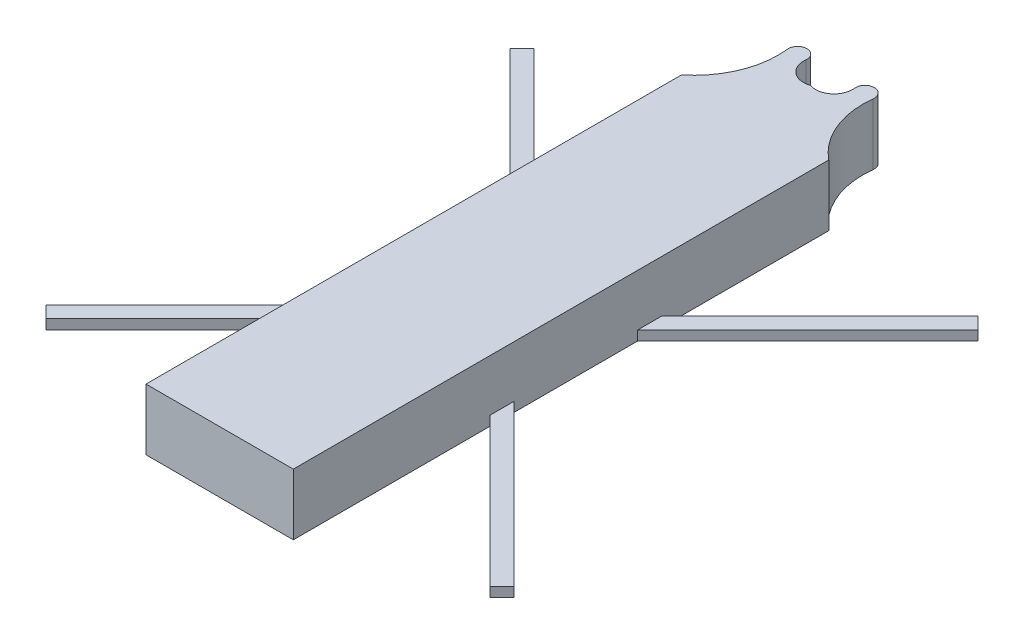
from build123d import *

# Parameters (mm, degrees)
BODY_DEPTH     = 29.21
ARM4_START     = -30.861
SKETCH3_W      = 8.1534
SKETCH3_H      = 4.572
ARM4_DEPTH     = 132.461
ARMS_COUNT     = 4
SPLIT1_DEPTH   = 4.572
SPLIT1_2_DEPTH = 4.572
SPLIT1_3_DEPTH = 4.572
SPLIT1_4_DEPTH = 4.572
SPLIT1_5_DEPTH = 4.572


# Read off the part's stored shape, not the designer's step: Split1
with BuildPart() as part:
    # Sketch1 → Body (new body)
    with BuildSketch(Plane(origin=(0, 0, 0), x_dir=(1, 0, 0), z_dir=(0, 1, 0))):
        with BuildLine():
            Line((-35.1155, -149.86), (35.1155, -149.86))
            Line((35.1155, -149.86), (35.1155, 105.41))
            ThreePointArc((35.1155, 105.41), (23.187155862, 121.433970368), (20.465438127, 141.224))
            ThreePointArc((20.465438127, 141.224), (16.0655, 146.16116691), (11.665561873, 141.224))
            ThreePointArc((11.665561873, 141.224), (8.42304611, 133.309752218), (0, 131.826))
            ThreePointArc((0, 131.826), (-8.42304611, 133.309752218), (-11.665561873, 141.224))
            ThreePointArc((-11.665561873, 141.224), (-16.0655, 146.16116691), (-20.465438127, 141.224))
            ThreePointArc((-20.465438127, 141.224), (-23.187155862, 121.433970368), (-35.1155, 105.41))
            Line((-35.1155, 105.41), (-35.1155, -149.86))
        make_face()
    extrude(amount=BODY_DEPTH)

    # Sketch3 → Arm4 (add)
    with BuildSketch(Plane(origin=(-33.996333455, 0, -33.996333455), x_dir=(-0.7071067811865487, 0, 0.7071067811865465), z_dir=(-0.7071067811865465, 0, -0.7071067811865487)).offset(ARM4_START)):
        with Locations((4.0767, 2.286)):
            Rectangle(SKETCH3_W, SKETCH3_H)
    arm4 = extrude(amount=ARM4_DEPTH)

    # Arms: Arm4 ×4 about axis
    arms_axis = Axis((0, 0, 10.484577686), (0, 1, 0))
    for i in range(1, ARMS_COUNT):
        add(arm4.rotate(arms_axis, i * 360 / ARMS_COUNT))

    # Split1 outline → Split1 (cut)
    with BuildSketch(Plane(origin=(0, 0, 0), x_dir=(1, 0, 0), z_dir=(0, 1, 0))):
        Polygon((-35.1155, 23.584851141), (-35.1155, 35.1155), (-105.838382424, 105.838382424), (-111.603706853, 100.073057994), align=None)
        Polygon((-35.1155, -46.646148859), (-35.1155, -35.1155), (-116.322960109, -116.322960109), (-110.55763568, -122.088284539), align=None)
        Polygon((35.1155, -44.554006512), (35.1155, -56.084655371), (105.838382424, -126.807537795), (111.603706853, -121.042213365), align=None)
        Polygon((35.1155, 25.676993488), (35.1155, 14.146344629), (116.322960109, 95.353804738), (110.55763568, 101.119129168), align=None)
    extrude(amount=SPLIT1_DEPTH, mode=Mode.SUBTRACT)


with BuildPart() as body_2:
    # Split1 2 outline → Split1 2 (new body)
    with BuildSketch(Plane(origin=(0, 0, 0), x_dir=(1, 0, 0), z_dir=(0, 1, 0))):
        Polygon((-35.1155, -46.646148859), (-35.1155, -35.1155), (-116.322960109, -116.322960109), (-110.55763568, -122.088284539), align=None)
    extrude(amount=SPLIT1_2_DEPTH)


with BuildPart() as body_3:
    # Split1 3 outline → Split1 3 (new body)
    with BuildSketch(Plane(origin=(0, 0, 0), x_dir=(1, 0, 0), z_dir=(0, 1, 0))):
        Polygon((-35.1155, 23.584851141), (-35.1155, 35.1155), (-105.838382424, 105.838382424), (-111.603706853, 100.073057994), align=None)
    extrude(amount=SPLIT1_3_DEPTH)


with BuildPart() as body_4:
    # Split1 4 outline → Split1 4 (new body)
    with BuildSketch(Plane(origin=(0, 0, 0), x_dir=(1, 0, 0), z_dir=(0, 1, 0))):
        Polygon((35.1155, 25.676993488), (35.1155, 14.146344629), (116.322960109, 95.353804738), (110.55763568, 101.119129168), align=None)
    extrude(amount=SPLIT1_4_DEPTH)


with BuildPart() as body_5:
    # Split1 5 outline → Split1 5 (new body)
    with BuildSketch(Plane(origin=(0, 0, 0), x_dir=(1, 0, 0), z_dir=(0, 1, 0))):
        Polygon((35.1155, -44.554006512), (35.1155, -56.084655371), (105.838382424, -126.807537795), (111.603706853, -121.042213365), align=None)
    extrude(amount=SPLIT1_5_DEPTH)


solid = Compound([part.part, body_2.part, body_3.part, body_4.part, body_5.part])
